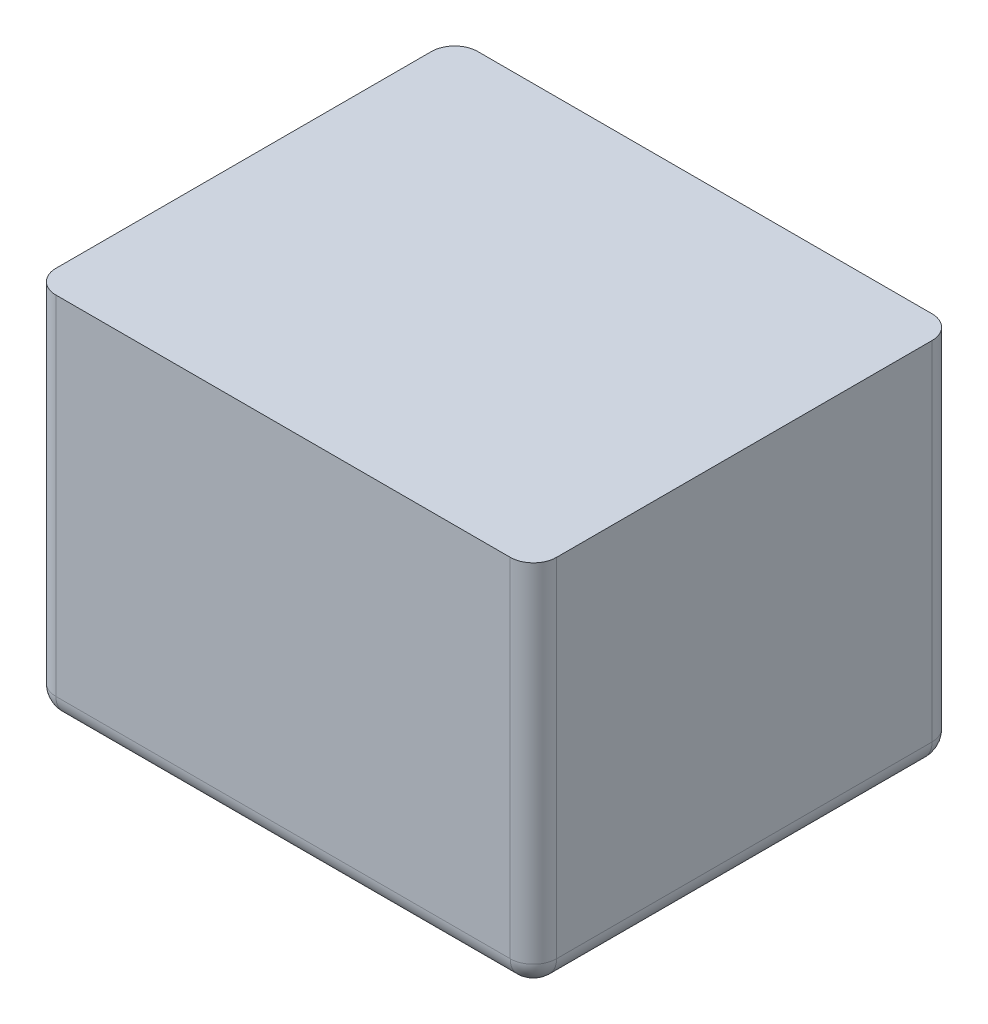
from build123d import *

# Parameters (mm, degrees)
SKIZZE1_W                       = 32.4
SKIZZE1_H                       = 27.3
AUFSATZ_LINEAR_AUSTRAGEN1_DEPTH = 24
VERRUNDUNG1_R                   = 1.5


with BuildPart() as part:
    # Skizze1 → Aufsatz-Linear austragen1 (new body)
    with BuildSketch(Plane(origin=(0, 0, 0), x_dir=(1, 0, 0), z_dir=(0, 1, 0))):
        Rectangle(SKIZZE1_W, SKIZZE1_H)
    extrude(amount=AUFSATZ_LINEAR_AUSTRAGEN1_DEPTH)

    # Verrundung1
    verrundung1_edges = [part.edges().sort_by_distance(p)[0] for p in [
        (16.2, 12, -13.65),
        (-16.2, 12, -13.65),
        (-16.2, 12, 13.65),
        (16.2, 12, 13.65),
        (0, 0, -13.65),
        (-16.2, 0, 0),
        (0, 0, 13.65),
        (16.2, 0, 0),
    ]]
    fillet(verrundung1_edges, radius=VERRUNDUNG1_R)


solid = part.part
